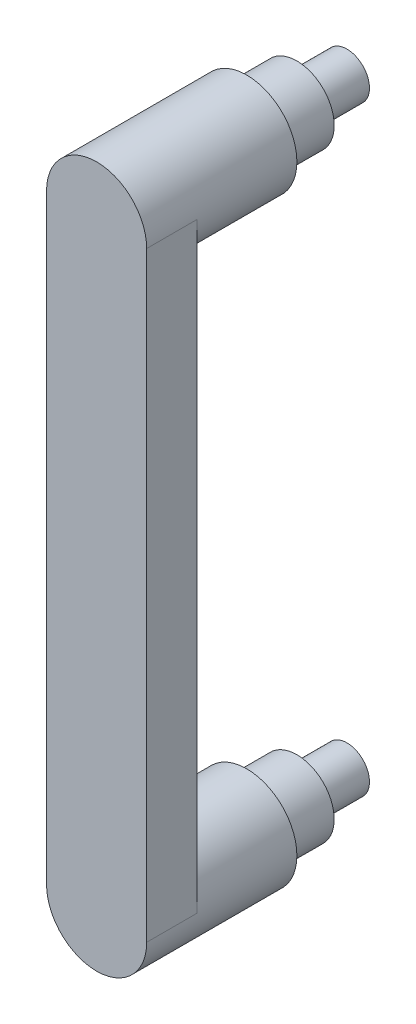
from build123d import *

# Parameters (mm, degrees)
SKETCH_1_R                       = 1.49
EXTRUDE_1_DEPTH                  = 4
SKETCH_2_R                       = 2
EXTRUDE_2_DEPTH                  = 4
EXTRUDE_START                    = 4
SKETCH_3_R                       = 2
EXTRUDE_3_DEPTH                  = 4
SKETCH_4_W                       = 4
SKETCH_4_H                       = 2
EXTRUDE_4_DEPTH                  = 12
EXTRUDE_4_DIRECTION_2_REACH      = 10.485
EXTRUDE_4_DIRECTION_2_END_RADIUS = 2
SKETCH_6_W                       = 4
SKETCH_6_H                       = 2
EXTRUDE_5_DEPTH                  = 12
EXTRUDE_5_DIRECTION_2_REACH      = 16.56
EXTRUDE_5_DIRECTION_2_END_RADIUS = 2
CUT_EXTRUDE_1_DEPTH              = 12
CUT_EXTRUDE_1_DEPTH_BACK         = 12
SKETCH_7_W                       = 8
SKETCH_7_H                       = 28
SKETCH_8_R                       = 0.9
EXTRUDE_6_DEPTH                  = 2


with BuildPart() as part:
    # 草图1 → 凸台-拉伸1 (new body)
    with BuildSketch(Plane.XY):
        Circle(SKETCH_1_R)
    extrude(amount=EXTRUDE_1_DEPTH)

    # 草图2 → 凸台-拉伸2 (add)
    with BuildSketch(Plane(origin=(0, 0, 0), x_dir=(-1, 0, 0), z_dir=(0, 0, -1))):
        Circle(SKETCH_2_R)
    extrude(amount=EXTRUDE_2_DEPTH)

    # 草图3 → 凸台-拉伸3 (add)
    with BuildSketch(Plane.XY.offset(4).offset(EXTRUDE_START)):
        Circle(SKETCH_3_R)
    extrude(amount=-EXTRUDE_3_DEPTH)

    # 草图4 → 凸台-拉伸4 (add)
    with BuildSketch(Plane(origin=(0, 0, 0), x_dir=(1, 0, 0), z_dir=(0, 1, 0))):
        with Locations((0, 5)):
            Rectangle(SKETCH_4_W, SKETCH_4_H)
    extrude(amount=EXTRUDE_4_DEPTH)

    # 凸台-拉伸4 direction 2: up to this cylinder (the profile starts inside it)
    extrude_4_direction_2_end = Plane(origin=(0, 0, -5), z_dir=(0, 0, 1)) * Cylinder(EXTRUDE_4_DIRECTION_2_END_RADIUS, 25.97, mode=Mode.PRIVATE)
    # 草图4 → 凸台-拉伸4 direction 2 (add, up to the surface)
    with BuildSketch(Plane(origin=(0, 0, 0), x_dir=(1, 0, 0), z_dir=(0, 1, 0)), mode=Mode.PRIVATE) as extrude_4_direction_2_sk1:
        with Locations((0, 5)):
            Rectangle(SKETCH_4_W, SKETCH_4_H)
    extrude_4_direction_2_tool1 = extrude(extrude_4_direction_2_sk1.sketch, amount=-EXTRUDE_4_DIRECTION_2_REACH, mode=Mode.PRIVATE) & extrude_4_direction_2_end
    add(extrude_4_direction_2_tool1.solids().sort_by_distance((0, 0, -5))[0])

    # 草图6 → 凸台-拉伸5 (add)
    with BuildSketch(Plane(origin=(0, 0, 0), x_dir=(1, 0, 0), z_dir=(0, 1, 0))):
        with Locations((0, -9)):
            Rectangle(SKETCH_6_W, SKETCH_6_H)
    extrude(amount=EXTRUDE_5_DEPTH)

    # 凸台-拉伸5 direction 2: up to this cylinder (the profile starts inside it)
    extrude_5_direction_2_end = Plane(origin=(0, 0, 9), z_dir=(0, 0, -1)) * Cylinder(EXTRUDE_5_DIRECTION_2_END_RADIUS, 38.12, mode=Mode.PRIVATE)
    # 草图6 → 凸台-拉伸5 direction 2 (add, up to the surface)
    with BuildSketch(Plane(origin=(0, 0, 0), x_dir=(1, 0, 0), z_dir=(0, 1, 0)), mode=Mode.PRIVATE) as extrude_5_direction_2_sk1:
        with Locations((0, -9)):
            Rectangle(SKETCH_6_W, SKETCH_6_H)
    extrude_5_direction_2_tool1 = extrude(extrude_5_direction_2_sk1.sketch, amount=-EXTRUDE_5_DIRECTION_2_REACH, mode=Mode.PRIVATE) & extrude_5_direction_2_end
    add(extrude_5_direction_2_tool1.solids().sort_by_distance((0, 0, 9))[0])

    # 镜向2: part across plane


with BuildPart() as part_1:
    add(part.part)
    add(part.part.mirror(Plane.ZX.offset(12)))

    # 草图7 → 切除-拉伸1 (cut, two sides: drawn at the far end of the back side and taken through both)
    with BuildSketch(Plane(origin=(0, 0, 0), x_dir=(0, 0, -1), z_dir=(1, 0, 0)).offset(-CUT_EXTRUDE_1_DEPTH_BACK)):
        with Locations((2, 12)):
            Rectangle(SKETCH_7_W, SKETCH_7_H)
    extrude(amount=CUT_EXTRUDE_1_DEPTH + CUT_EXTRUDE_1_DEPTH_BACK, mode=Mode.SUBTRACT)

    # 草图8 → 凸台-拉伸6 (add)
    with BuildSketch(Plane(origin=(0, 0, 2), x_dir=(-1, 0, 0), z_dir=(0, 0, -1))):
        with Locations((0, 24)):
            Circle(SKETCH_8_R)
        Circle(SKETCH_8_R)
    extrude(amount=EXTRUDE_6_DEPTH)


solid = part_1.part
